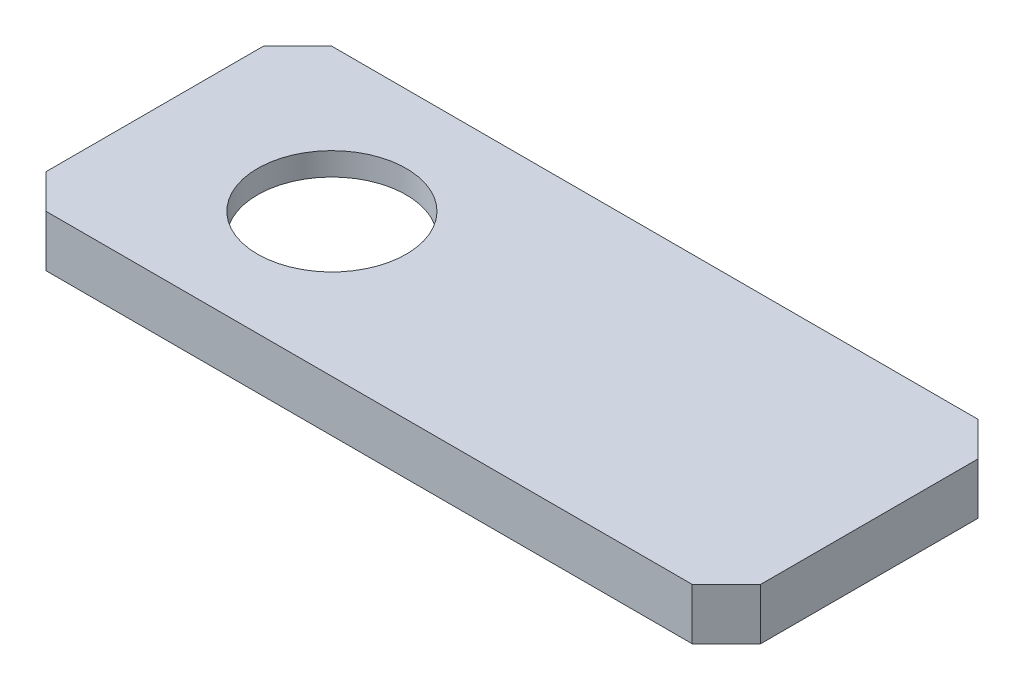
from build123d import *

# Parameters (mm, degrees)
SKETCH_1_R          = 1.45
EXTRUDE_1_DEPTH     = 2.5
EXTRUDE_2_DEPTH     = 2
SKETCH_3_R          = 6.5
CUT_EXTRUDE_1_DEPTH = 39.98910969
SKETCH_4_R          = 1.45
CUT_EXTRUDE_2_DEPTH = 1
SKETCH_6_R          = 5
CUT_EXTRUDE_4_DEPTH = 1


with BuildPart() as part:
    # Эскиз1 → Бобышка-Вытянуть1 (new body)
    with BuildSketch(Plane(origin=(0, 0, 0), x_dir=(1, 0, 0), z_dir=(0, 1, 0))):
        Polygon((35.593108597, -12.265362584), (35.593108597, 6.734637416), (32.593108597, 9.734637416), (-23.906891403, 9.734637416), (-26.906891403, 6.734637416), (-26.906891403, -12.265362584), (-23.906891403, -15.265362584), (32.593108597, -15.265362584), align=None)
        with Locations((-22.906891403, -11.765362584)):
            Circle(SKETCH_1_R, mode=Mode.SUBTRACT)
        with BuildLine():
            Line((25.893108597, 8.234637416), (-15.606891403, 8.234637416))
            Line((-15.606891403, 8.234637416), (-24.906891403, 2.234637416))
            Line((-24.906891403, 2.234637416), (-24.906891403, -8.765362584))
            Line((-24.906891403, -8.765362584), (-15.008932433, -13.765362584))
            Line((-15.008932433, -13.765362584), (26.491067567, -13.765362584))
            Line((26.491067567, -13.765362584), (33.593108597, -10.265362584))
            Line((33.593108597, -10.265362584), (33.593108597, 4.734637416))
            Line((33.593108597, 4.734637416), (32.596332637, 5.187717397))
            ThreePointArc((32.596332637, 5.187717397), (32.193122866, 7.554668808), (30.144679077, 6.302105379))
            Line((30.144679077, 6.302105379), (25.893108597, 8.234637416))
        make_face(mode=Mode.SUBTRACT)
    extrude(amount=EXTRUDE_1_DEPTH)

    # Эскиз2 → Бобышка-Вытянуть2 (add)
    with BuildSketch(Plane(origin=(0, 2.5, 0), x_dir=(1, 0, 0), z_dir=(0, 1, 0))):
        Polygon((32.593108597, -15.265362584), (35.593108597, -12.265362584), (35.593108597, 6.734637416), (32.593108597, 9.734637416), (-23.906891403, 9.734637416), (-26.906891403, 6.734637416), (-26.906891403, -12.265362584), (-23.906891403, -15.265362584), align=None)
    extrude(amount=EXTRUDE_2_DEPTH)

    # Эскиз3 → Вырез-Вытянуть1 (cut, through all)
    with BuildSketch(Plane(origin=(0, 4.5, 0), x_dir=(1, 0, 0), z_dir=(0, 1, 0))):
        with Locations((-11.406891403, -2.765362584)):
            Circle(SKETCH_3_R)
    extrude(amount=-CUT_EXTRUDE_1_DEPTH, mode=Mode.SUBTRACT)

    # Эскиз4 → Вырез-Вытянуть2 (cut)
    with BuildSketch(Plane.XZ.offset(-2.5)):
        with Locations((31.593108597, -6.234637416)):
            Circle(SKETCH_4_R)
        with Locations((-22.906891403, 11.765362584)):
            Circle(SKETCH_4_R)
    extrude(amount=-CUT_EXTRUDE_2_DEPTH, mode=Mode.SUBTRACT)

    # Эскиз6 → Вырез-Вытянуть4 (cut)
    with BuildSketch(Plane.XZ.offset(-2.5)):
        with Locations((4.343108597, 2.765362584)):
            Circle(SKETCH_6_R)
    extrude(amount=-CUT_EXTRUDE_4_DEPTH, mode=Mode.SUBTRACT)


solid = part.part
